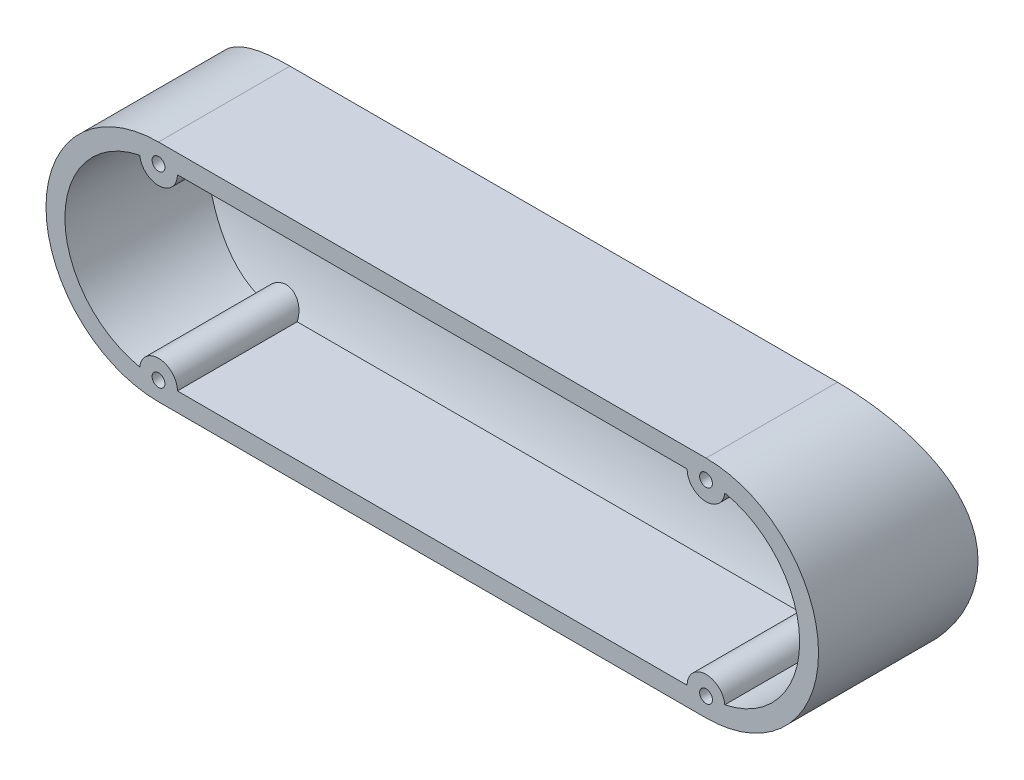
from build123d import *

# Parameters (mm, degrees)
BOSS_EXTRUDE2_DEPTH                          = 45
CUT_EXTRUDE1_START                           = -120
CUT_EXTRUDE1_DEPTH                           = 207
CBORE_FOR_M3_HEX_SOCKET_HEAD_CAP_SCR_2_COUNT = 2
CBORE_FOR_M3_HEX_SOCKET_HEAD_CAP_SCR_2_PITCH = 145
CBORE_FOR_M3_HEX_SOCKET_HEAD_CAP_SCR_3_COUNT = 2
CBORE_FOR_M3_HEX_SOCKET_HEAD_CAP_SCR_3_PITCH = 153.248686781
CBORE_FOR_M3_HEX_SOCKET_HEAD_CAP_SCR_4_COUNT = 2
CBORE_FOR_M3_HEX_SOCKET_HEAD_CAP_SCR_4_PITCH = 49.6
CUT_EXTRUDE2_REACH                           = 227.539
CUT_EXTRUDE2_END_RADIUS                      = 58.5
CUT_EXTRUDE2_DIRECTION_2_DEPTH               = 226.538529612


with BuildPart() as part:
    # Sketch2 → Boss-Extrude2 (new body)
    with BuildSketch(Plane.XY):
        with BuildLine():
            Line((56.132610552, -127.487790866), (-88.867389448, -127.487790866))
            ThreePointArc((-88.867389448, -127.487790866), (-118.667389448, -157.287790866), (-88.867389448, -187.087790866))
            Line((-88.867389448, -187.087790866), (56.132610552, -187.087790866))
            ThreePointArc((56.132610552, -187.087790866), (85.932610552, -157.287790866), (56.132610552, -127.487790866))
        make_face()
    extrude(amount=-BOSS_EXTRUDE2_DEPTH)

    # Cut-Extrude1: read off the stored shape, not the designer's step
    # Cut-Extrude1 outline → Cut-Extrude1 (cut)
    with BuildSketch(Plane(origin=(0, 0, 0), x_dir=(0, 0, -1), z_dir=(1, 0, 0)).offset(CUT_EXTRUDE1_START)):
        with BuildLine():
            ThreePointArc((34.808748648, -127.487777676), (42.2355, -157.287790865), (34.808748648, -187.087804055))
            Line((34.808748648, -187.087804055), (45, -187.087790866))
            Line((45, -187.087790866), (45, -127.487790866))
            Line((45, -127.487790866), (34.808748648, -127.487777676))
        make_face()
    extrude(amount=CUT_EXTRUDE1_DEPTH, mode=Mode.SUBTRACT)

    # Sketch6 → CBORE for M3 Hex Socket Head Cap Screw1 (revolve, cut)
    with BuildSketch(Plane(origin=(56.132610552, -132.487790866, -40), x_dir=(0, 1, 0), z_dir=(1, 0, 0))):
        Polygon((0, 0), (0, 40), (1.7, 40), (1.7, 30), (3.25, 30), (3.25, 0.025), (3.275, 0), align=None)
    cbore_for_m3_hex_socket_head_cap_screw1 = revolve(axis=Axis((56.132610552, -132.487790866, -46.35), (0, 0, 1)), mode=Mode.SUBTRACT)

    # CBORE for M3 Hex Socket Head Cap Scr 2: CBORE for M3 Hex Socket Head Cap Screw1 ×2
    with Locations(*[(-i * CBORE_FOR_M3_HEX_SOCKET_HEAD_CAP_SCR_2_PITCH, 0, 0) for i in range(1, CBORE_FOR_M3_HEX_SOCKET_HEAD_CAP_SCR_2_COUNT)]):
        add(cbore_for_m3_hex_socket_head_cap_screw1, mode=Mode.SUBTRACT)

    # CBORE for M3 Hex Socket Head Cap Scr 3: CBORE for M3 Hex Socket Head Cap Screw1 ×2
    with Locations(*[Vector(-0.9461745026730805, -0.32365693332809825, 0) * (i * CBORE_FOR_M3_HEX_SOCKET_HEAD_CAP_SCR_3_PITCH) for i in range(1, CBORE_FOR_M3_HEX_SOCKET_HEAD_CAP_SCR_3_COUNT)]):
        add(cbore_for_m3_hex_socket_head_cap_screw1, mode=Mode.SUBTRACT)

    # CBORE for M3 Hex Socket Head Cap Scr 4: CBORE for M3 Hex Socket Head Cap Screw1 ×2
    with Locations(*[(0, -i * CBORE_FOR_M3_HEX_SOCKET_HEAD_CAP_SCR_4_PITCH, 0) for i in range(1, CBORE_FOR_M3_HEX_SOCKET_HEAD_CAP_SCR_4_COUNT)]):
        add(cbore_for_m3_hex_socket_head_cap_screw1, mode=Mode.SUBTRACT)

    # Cut-Extrude2: up to this cylinder (the profile starts inside it)
    cut_extrude2_end = Plane(origin=(-16.367389, -157.287790866, 21.2645), z_dir=(1, 0, 0)) * Cylinder(CUT_EXTRUDE2_END_RADIUS, 573.078, mode=Mode.PRIVATE)
    # Sketch7 → Cut-Extrude2 (cut, up to the surface)
    with BuildSketch(Plane.XY, mode=Mode.PRIVATE) as cut_extrude2_sk1:
        with BuildLine():
            ThreePointArc((-93.841919726, -181.583758608), (-88.615051766, -177.094162356), (-83.867389448, -182.087790866))
            Line((-83.867389448, -182.087790866), (51.132610552, -182.087790866))
            ThreePointArc((51.132610552, -182.087790866), (55.88027287, -177.094162356), (61.10714083, -181.583758608))
            ThreePointArc((61.10714083, -181.583758608), (80.932610552, -157.287790866), (61.10714083, -132.991823124))
            ThreePointArc((61.10714083, -132.991823124), (55.88027287, -137.481419376), (51.132610552, -132.487790866))
            Line((51.132610552, -132.487790866), (-83.867389448, -132.487790866))
            ThreePointArc((-83.867389448, -132.487790866), (-88.615051766, -137.481419376), (-93.841919726, -132.991823124))
            ThreePointArc((-93.841919726, -132.991823124), (-113.667389448, -157.287790866), (-93.841919726, -181.583758608))
        make_face()
    cut_extrude2_tool1 = extrude(cut_extrude2_sk1.sketch, amount=-CUT_EXTRUDE2_REACH, mode=Mode.PRIVATE) & cut_extrude2_end
    add(cut_extrude2_tool1.solids().sort_by_distance((-16.367389, -157.287791, 0))[0], mode=Mode.SUBTRACT)

    # Sketch7 → Cut-Extrude2 direction 2 (cut)
    with BuildSketch(Plane.XY):
        with BuildLine():
            ThreePointArc((-93.841919726, -181.583758608), (-88.615051766, -177.094162356), (-83.867389448, -182.087790866))
            Line((-83.867389448, -182.087790866), (51.132610552, -182.087790866))
            ThreePointArc((51.132610552, -182.087790866), (55.88027287, -177.094162356), (61.10714083, -181.583758608))
            ThreePointArc((61.10714083, -181.583758608), (80.932610552, -157.287790866), (61.10714083, -132.991823124))
            ThreePointArc((61.10714083, -132.991823124), (55.88027287, -137.481419376), (51.132610552, -132.487790866))
            Line((51.132610552, -132.487790866), (-83.867389448, -132.487790866))
            ThreePointArc((-83.867389448, -132.487790866), (-88.615051766, -137.481419376), (-93.841919726, -132.991823124))
            ThreePointArc((-93.841919726, -132.991823124), (-113.667389448, -157.287790866), (-93.841919726, -181.583758608))
        make_face()
    extrude(amount=CUT_EXTRUDE2_DIRECTION_2_DEPTH, mode=Mode.SUBTRACT)


solid = part.part
